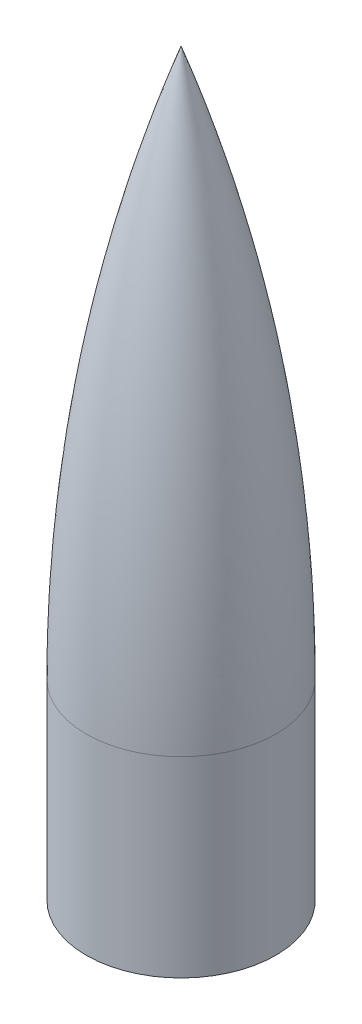
from build123d import *


with BuildPart() as part:
    # Sketch1 → Revolve1 (revolve)
    with BuildSketch(Plane.XY):
        with BuildLine():
            Line((0, 229), (0, 219.905427331))
            ThreePointArc((0, 219.905427331), (27.387497442, 111.465192964), (36.6, 0))
            Line((36.6, 0), (36.6, -80))
            Line((36.6, -80), (39.6, -80))
            Line((39.6, -80), (39.6, 0))
            ThreePointArc((39.6, 0), (29.627075608, 116.199354559), (0, 229))
        make_face()
    revolve(axis=Axis((0, 229, 0), (0, -1, 0)))


solid = part.part
